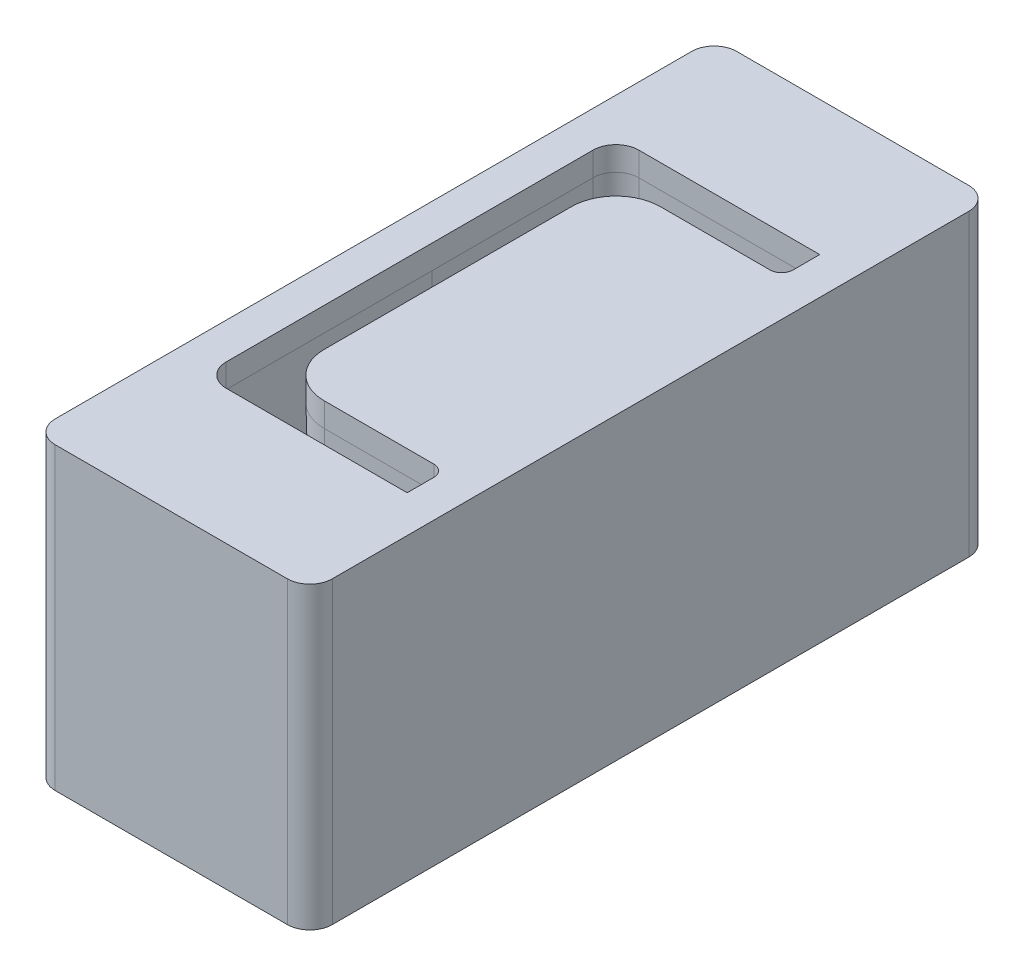
from build123d import *

# Parameters (mm, degrees)
SKETCH1_W             = 37
SKETCH1_H             = 91
BOSS_EXTRUDE1_DEPTH   = 40
FILLET1_R             = 3
CUT_EXTRUDE1_REACH    = 71.233
M8_TAPPED_HOLE1_D     = 6.8
M8_TAPPED_HOLE1_DEPTH = 22.25
M8_TAPPED_HOLE1_TIP   = 2.042926105


with BuildPart() as part:
    # Sketch1 → Boss-Extrude1 (new body)
    with BuildSketch(Plane(origin=(0, 0, 0), x_dir=(1, 0, 0), z_dir=(0, 1, 0))):
        with Locations((10.5, -3)):
            Rectangle(SKETCH1_W, SKETCH1_H)
    extrude(amount=-BOSS_EXTRUDE1_DEPTH)

    # Fillet1
    fillet1_edges = [part.edges().sort_by_distance(p)[0] for p in [
        (-8, -20, -42.5),
        (29, -20, -42.5),
        (29, -20, 48.5),
        (-8, -20, 48.5),
    ]]
    fillet(fillet1_edges, radius=FILLET1_R)

    # Sketch2 → Cut-Extrude1 (cut, up to next)
    with BuildSketch(Plane(origin=(0, 0, 0), x_dir=(1, 0, 0), z_dir=(0, 1, 0)), mode=Mode.PRIVATE) as cut_extrude1_sk1:
        with BuildLine():
            Line((24.05, 24.55), (-0.12, 24.55))
            ThreePointArc((-0.12, 24.55), (-2.276675683, 23.656675683), (-3.17, 21.5))
            Line((-3.17, 21.5), (-3.17, -27.5))
            ThreePointArc((-3.17, -27.5), (-2.276675683, -29.656675683), (-0.12, -30.55))
            Line((-0.12, -30.55), (24.05, -30.55))
            Line((24.05, -30.55), (24.05, -27))
            ThreePointArc((24.05, -27), (23.596015511, -25.903984489), (22.5, -25.45))
            Line((22.5, -25.45), (7.88, -25.45))
            ThreePointArc((7.88, -25.45), (3.672714652, -23.707285348), (1.93, -19.5))
            Line((1.93, -19.5), (1.93, 13.5))
            ThreePointArc((1.93, 13.5), (3.672714652, 17.707285348), (7.88, 19.45))
            Line((7.88, 19.45), (22.5, 19.45))
            ThreePointArc((22.5, 19.45), (23.596015511, 19.903984489), (24.05, 21))
            Line((24.05, 21), (24.05, 24.55))
        make_face()
    cut_extrude1_tool1 = extrude(cut_extrude1_sk1.sketch, amount=-CUT_EXTRUDE1_REACH, mode=Mode.PRIVATE) & part.part
    add(cut_extrude1_tool1.solids().sort_by_distance((3.238149, 0, -18.141851))[0], mode=Mode.SUBTRACT)

    # Cut-Sweep1: sweep along a path in Sketch4
    with BuildLine(Plane(origin=(0, 0, 0), x_dir=(1, 0, 0), z_dir=(0, 1, 0))) as cut_sweep1_path:
        Line((24.05, 21), (24.05, 24.55))
        Line((24.05, 24.55), (-0.12, 24.55))
        ThreePointArc((-0.12, 24.55), (-2.276675683, 23.656675683), (-3.17, 21.5))
        Line((-3.17, 21.5), (-3.17, -27.5))
        ThreePointArc((-3.17, -27.5), (-2.276675683, -29.656675683), (-0.12, -30.55))
        Line((-0.12, -30.55), (24.05, -30.55))
        Line((24.05, -30.55), (24.05, -27))
        ThreePointArc((24.05, -27), (23.596015511, -25.903984489), (22.5, -25.45))
        Line((22.5, -25.45), (7.88, -25.45))
        ThreePointArc((7.88, -25.45), (3.672714652, -23.707285348), (1.93, -19.5))
        Line((1.93, -19.5), (1.93, 13.5))
        ThreePointArc((1.93, 13.5), (3.672714652, 17.707285348), (7.88, 19.45))
        Line((7.88, 19.45), (22.5, 19.45))
        ThreePointArc((22.5, 19.45), (23.596015511, 19.903984489), (24.05, 21))
    # Sketch3 → Cut-Sweep1 (sweep, cut)
    with BuildSketch(Plane.XY):
        Polygon((-3.17, -3.2), (-3.812346389, -40), (-3.17, -40), align=None)
    sweep(path=cut_sweep1_path.line, transition=Transition.RIGHT, mode=Mode.SUBTRACT)

    # M8 Tapped Hole1
    with Locations(Plane(origin=(0, -40, 0), x_dir=(-1, 0, 0), z_dir=(0, -1, 0))):
        with Locations((-10.5, 33.846173195), (-10.5, -39.846173195)):
            Hole(M8_TAPPED_HOLE1_D / 2, depth=M8_TAPPED_HOLE1_DEPTH)
            with Locations((0, 0, -(M8_TAPPED_HOLE1_DEPTH + M8_TAPPED_HOLE1_TIP / 2))):  # 118° drill point
                Cone(0, M8_TAPPED_HOLE1_D / 2, M8_TAPPED_HOLE1_TIP, mode=Mode.SUBTRACT)


solid = part.part
